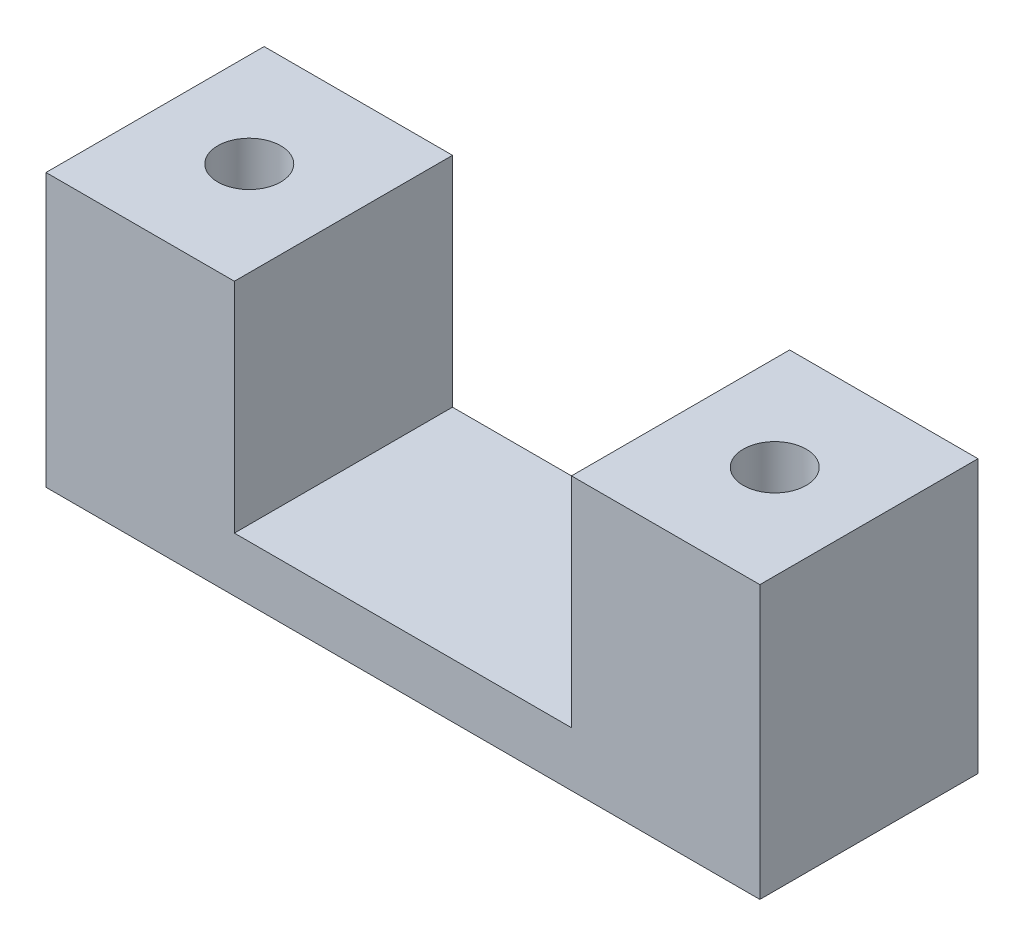
from build123d import *

# Parameters (mm, degrees)
SKETCH1_W           = 72
SKETCH1_H           = 22
BOSS_EXTRUDE1_DEPTH = 27.5
SKETCH2_W           = 34
SKETCH2_H           = 22
CUT_EXTRUDE1_DEPTH  = 22
SKETCH3_R           = 3.175
CUT_EXTRUDE2_DEPTH  = 69
SKETCH5_R           = 5.5
CUT_EXTRUDE3_DEPTH  = 5.5


with BuildPart() as part:
    # Sketch1 → Boss-Extrude1 (new body)
    with BuildSketch(Plane(origin=(0, 0, 0), x_dir=(1, 0, 0), z_dir=(0, 1, 0))):
        with Locations((36, 11)):
            Rectangle(SKETCH1_W, SKETCH1_H)
    extrude(amount=BOSS_EXTRUDE1_DEPTH)

    # Sketch2 → Cut-Extrude1 (cut)
    with BuildSketch(Plane(origin=(0, 27.5, 0), x_dir=(1, 0, 0), z_dir=(0, 1, 0))):
        with Locations((36, 11)):
            Rectangle(SKETCH2_W, SKETCH2_H)
    extrude(amount=-CUT_EXTRUDE1_DEPTH, mode=Mode.SUBTRACT)

    # Sketch3 → Cut-Extrude2 (cut)
    with BuildSketch(Plane(origin=(0, 27.5, 0), x_dir=(1, 0, 0), z_dir=(0, 1, 0))):
        with Locations((9.5, 11)):
            Circle(SKETCH3_R)
        with Locations((62.5, 11)):
            Circle(SKETCH3_R)
    extrude(amount=-CUT_EXTRUDE2_DEPTH, mode=Mode.SUBTRACT)

    # Sketch5 → Cut-Extrude3 (cut)
    with BuildSketch(Plane.XZ):
        with Locations((9.5, -11)):
            Circle(SKETCH5_R)
        with Locations((62.5, -11)):
            Circle(SKETCH5_R)
    extrude(amount=-CUT_EXTRUDE3_DEPTH, mode=Mode.SUBTRACT)


solid = part.part
